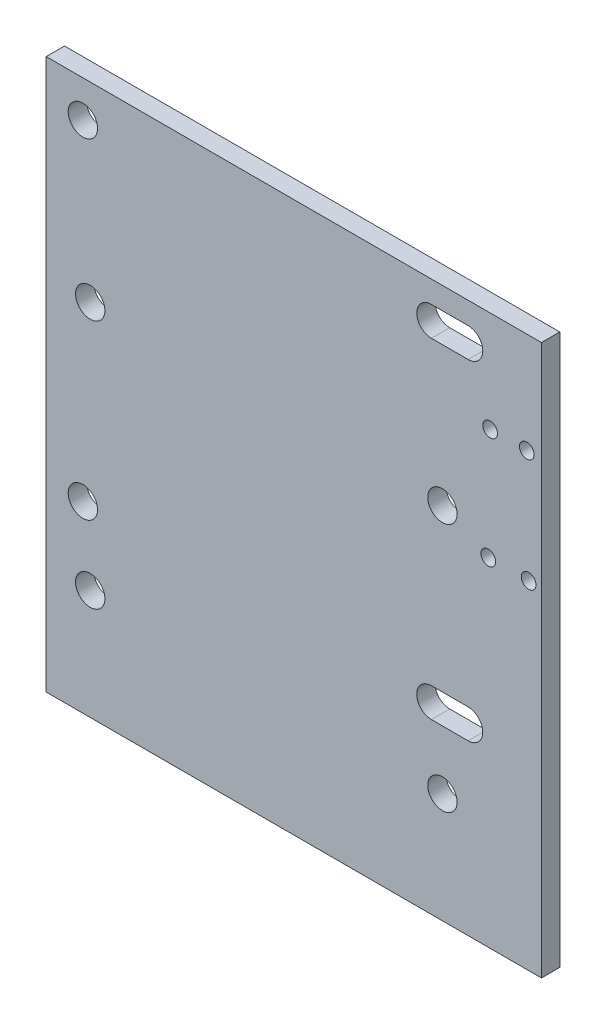
from build123d import *

# Parameters (mm, degrees)
SKETCH1_W           = 135
SKETCH1_H           = 150
BOSS_EXTRUDE1_DEPTH = 5
CUT_EXTRUDE1_REACH  = 103.026
SKETCH2_R           = 4
CUT_EXTRUDE5_REACH  = 103.026
SKETCH6_R           = 4
CUT_EXTRUDE6_REACH  = 103.026
SKETCH7_R           = 2


with BuildPart() as part:
    # Sketch1 → Boss-Extrude1 (new body)
    with BuildSketch(Plane.XY):
        Rectangle(SKETCH1_W, SKETCH1_H)
    extrude(amount=BOSS_EXTRUDE1_DEPTH)

    # Sketch2 → Cut-Extrude1 (cut, up to next)
    with BuildSketch(Plane.XY.offset(5), mode=Mode.PRIVATE) as cut_extrude1_sk1:
        with Locations((-57.5, 65)):
            Circle(SKETCH2_R)
    cut_extrude1_tool1 = extrude(cut_extrude1_sk1.sketch, amount=-CUT_EXTRUDE1_REACH, mode=Mode.PRIVATE) & part.part
    # Sketch2 → Cut-Extrude1 (cut, up to next)
    with BuildSketch(Plane.XY.offset(5), mode=Mode.PRIVATE) as cut_extrude1_sk2:
        with Locations((-57.5, -25)):
            Circle(SKETCH2_R)
    cut_extrude1_tool2 = extrude(cut_extrude1_sk2.sketch, amount=-CUT_EXTRUDE1_REACH, mode=Mode.PRIVATE) & part.part
    # Sketch2 → Cut-Extrude1 (cut, up to next)
    with BuildSketch(Plane.XY.offset(5), mode=Mode.PRIVATE) as cut_extrude1_sk3:
        with BuildLine():
            Line((37.5, 69), (47.5, 69))
            ThreePointArc((47.5, 69), (51.5, 65), (47.5, 61))
            Line((47.5, 61), (37.5, 61))
            ThreePointArc((37.5, 61), (33.5, 65), (37.5, 69))
        make_face()
    cut_extrude1_tool3 = extrude(cut_extrude1_sk3.sketch, amount=-CUT_EXTRUDE1_REACH, mode=Mode.PRIVATE) & part.part
    # Sketch2 → Cut-Extrude1 (cut, up to next)
    with BuildSketch(Plane.XY.offset(5), mode=Mode.PRIVATE) as cut_extrude1_sk4:
        with BuildLine():
            Line((37.5, -29), (47.5, -29))
            ThreePointArc((47.5, -29), (51.5, -25), (47.5, -21))
            Line((47.5, -21), (37.5, -21))
            ThreePointArc((37.5, -21), (33.5, -25), (37.5, -29))
        make_face()
    cut_extrude1_tool4 = extrude(cut_extrude1_sk4.sketch, amount=-CUT_EXTRUDE1_REACH, mode=Mode.PRIVATE) & part.part
    add(cut_extrude1_tool1.solids().sort_by_distance((-57.5, 65, 5))[0], mode=Mode.SUBTRACT)
    add(cut_extrude1_tool2.solids().sort_by_distance((-57.5, -25, 5))[0], mode=Mode.SUBTRACT)
    add(cut_extrude1_tool3.solids().sort_by_distance((42.5, 65, 5))[0], mode=Mode.SUBTRACT)
    add(cut_extrude1_tool4.solids().sort_by_distance((42.5, -25, 5))[0], mode=Mode.SUBTRACT)

    # Sketch6 → Cut-Extrude5 (cut, up to next)
    with BuildSketch(Plane.XY.offset(5), mode=Mode.PRIVATE) as cut_extrude5_sk1:
        with Locations((-55.5, 23)):
            Circle(SKETCH6_R)
    cut_extrude5_tool1 = extrude(cut_extrude5_sk1.sketch, amount=-CUT_EXTRUDE5_REACH, mode=Mode.PRIVATE) & part.part
    # Sketch6 → Cut-Extrude5 (cut, up to next)
    with BuildSketch(Plane.XY.offset(5), mode=Mode.PRIVATE) as cut_extrude5_sk2:
        with Locations((-55.5, -45)):
            Circle(SKETCH6_R)
    cut_extrude5_tool2 = extrude(cut_extrude5_sk2.sketch, amount=-CUT_EXTRUDE5_REACH, mode=Mode.PRIVATE) & part.part
    # Sketch6 → Cut-Extrude5 (cut, up to next)
    with BuildSketch(Plane.XY.offset(5), mode=Mode.PRIVATE) as cut_extrude5_sk3:
        with Locations((40.5, 23)):
            Circle(SKETCH6_R)
    cut_extrude5_tool3 = extrude(cut_extrude5_sk3.sketch, amount=-CUT_EXTRUDE5_REACH, mode=Mode.PRIVATE) & part.part
    # Sketch6 → Cut-Extrude5 (cut, up to next)
    with BuildSketch(Plane.XY.offset(5), mode=Mode.PRIVATE) as cut_extrude5_sk4:
        with Locations((40.5, -45)):
            Circle(SKETCH6_R)
    cut_extrude5_tool4 = extrude(cut_extrude5_sk4.sketch, amount=-CUT_EXTRUDE5_REACH, mode=Mode.PRIVATE) & part.part
    add(cut_extrude5_tool1.solids().sort_by_distance((-55.5, 23, 5))[0], mode=Mode.SUBTRACT)
    add(cut_extrude5_tool2.solids().sort_by_distance((-55.5, -45, 5))[0], mode=Mode.SUBTRACT)
    add(cut_extrude5_tool3.solids().sort_by_distance((40.5, 23, 5))[0], mode=Mode.SUBTRACT)
    add(cut_extrude5_tool4.solids().sort_by_distance((40.5, -45, 5))[0], mode=Mode.SUBTRACT)

    # Sketch7 → Cut-Extrude6 (cut, up to next)
    with BuildSketch(Plane(origin=(0, 0, 0), x_dir=(-1, 0, 0), z_dir=(0, 0, -1)), mode=Mode.PRIVATE) as cut_extrude6_sk1:
        with Locations((-63.5, 47.5)):
            Circle(SKETCH7_R)
    cut_extrude6_tool1 = extrude(cut_extrude6_sk1.sketch, amount=-CUT_EXTRUDE6_REACH, mode=Mode.PRIVATE) & part.part
    # Sketch7 → Cut-Extrude6 (cut, up to next)
    with BuildSketch(Plane(origin=(0, 0, 0), x_dir=(-1, 0, 0), z_dir=(0, 0, -1)), mode=Mode.PRIVATE) as cut_extrude6_sk2:
        with Locations((-53.5, 47.5)):
            Circle(SKETCH7_R)
    cut_extrude6_tool2 = extrude(cut_extrude6_sk2.sketch, amount=-CUT_EXTRUDE6_REACH, mode=Mode.PRIVATE) & part.part
    # Sketch7 → Cut-Extrude6 (cut, up to next)
    with BuildSketch(Plane(origin=(0, 0, 0), x_dir=(-1, 0, 0), z_dir=(0, 0, -1)), mode=Mode.PRIVATE) as cut_extrude6_sk3:
        with Locations((-64, 17)):
            Circle(SKETCH7_R)
    cut_extrude6_tool3 = extrude(cut_extrude6_sk3.sketch, amount=-CUT_EXTRUDE6_REACH, mode=Mode.PRIVATE) & part.part
    # Sketch7 → Cut-Extrude6 (cut, up to next)
    with BuildSketch(Plane(origin=(0, 0, 0), x_dir=(-1, 0, 0), z_dir=(0, 0, -1)), mode=Mode.PRIVATE) as cut_extrude6_sk4:
        with Locations((-53, 17)):
            Circle(SKETCH7_R)
    cut_extrude6_tool4 = extrude(cut_extrude6_sk4.sketch, amount=-CUT_EXTRUDE6_REACH, mode=Mode.PRIVATE) & part.part
    add(cut_extrude6_tool1.solids().sort_by_distance((63.5, 47.5, 0))[0], mode=Mode.SUBTRACT)
    add(cut_extrude6_tool2.solids().sort_by_distance((53.5, 47.5, 0))[0], mode=Mode.SUBTRACT)
    add(cut_extrude6_tool3.solids().sort_by_distance((64, 17, 0))[0], mode=Mode.SUBTRACT)
    add(cut_extrude6_tool4.solids().sort_by_distance((53, 17, 0))[0], mode=Mode.SUBTRACT)


solid = part.part
